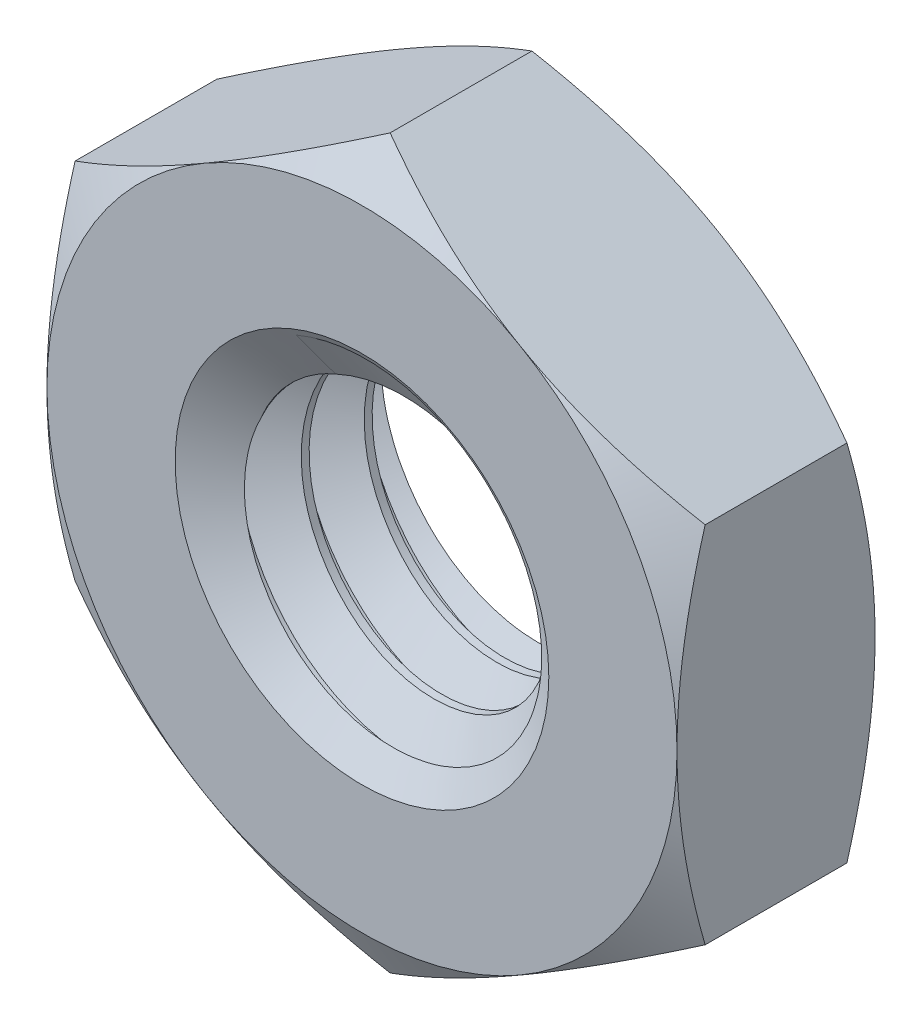
from build123d import *

# Parameters (mm, degrees)
SKETCH3_R                    = 2
BOSS_EXTRUDE1_DEPTH          = 1.1
SKETCH4_OUTSIDE_W            = 45.824
SKETCH4_OUTSIDE_H            = 46.906
SKETCH4_OUTSIDE_R            = 3.5
CUT_EXTRUDE1_DEPTH           = 10
CUT_EXTRUDE1_DRAFT           = -60
SKETCH4_OUTSIDE_R_2          = 2.075777223
CUT_EXTRUDE1_PROFILE_2_DEPTH = 10
CUT_EXTRUDE1_PROFILE_2_DRAFT = -60
MIRROR1_COPY_1_SKETCH_W      = 45.824
MIRROR1_COPY_1_SKETCH_H      = 46.906
MIRROR1_COPY_1_SKETCH_R      = 3.5
MIRROR1_COPY_1_DEPTH         = 10
MIRROR1_COPY_1_DRAFT         = -60
MIRROR1_COPY_2_SKETCH_R      = 2.075777223
MIRROR1_COPY_2_DEPTH         = 10
MIRROR1_COPY_2_DRAFT         = -60
MIRROR1_COPY_3_SKETCH_R      = 2.075777223
MIRROR1_COPY_3_DEPTH         = 10
MIRROR1_COPY_3_DRAFT         = -60
SWEEP1_PITCH                 = 0.7
SKETCH8_R                    = 2.075777223
CUT_EXTRUDE2_OTHER_WAY_DEPTH = 7.0926749


# Read off the part's stored shape, not the designer's step: Mirror2
with BuildPart() as part:
    # Sketch3 → Boss-Extrude1 (new, symmetric)
    with BuildSketch(Plane.XY):
        Polygon((-3.5, 2.020725942), (-3.5, -2.020725942), (0, -4.041451884), (3.5, -2.020725942), (3.5, 2.020725942), (0, 4.041451884), align=None)
        Circle(SKETCH3_R, mode=Mode.SUBTRACT)
    extrude(amount=BOSS_EXTRUDE1_DEPTH, both=True)


with BuildPart() as cut_extrude1_tool:
    # Sketch4 outside → Cut-Extrude1 (with draft: the straight prism first)
    with BuildSketch(Plane.XY.offset(1.1)):
        Rectangle(SKETCH4_OUTSIDE_W, SKETCH4_OUTSIDE_H)
        Circle(SKETCH4_OUTSIDE_R, mode=Mode.SUBTRACT)
    extrude(amount=-CUT_EXTRUDE1_DEPTH)
    # Cut-Extrude1: the draft: its side faces are tilted about the plane it starts from
    cut_extrude1_sides = [cut_extrude1_tool.faces().sort_by_distance(p)[0] for p in [
        (0, -23.453, -3.9),
        (22.912, 0, -3.9),
        (0, 23.453, -3.9),
        (-22.912, 0, -3.9),
        (-3.5, 0, -3.9),
    ]]
    draft(cut_extrude1_sides, Plane.XY.offset(1.1), CUT_EXTRUDE1_DRAFT)


with BuildPart() as part_1:
    add(part.part)

    # Cut-Extrude1: cut by cut_extrude1_tool
    add(cut_extrude1_tool.part, mode=Mode.SUBTRACT)


with BuildPart() as cut_extrude1_profile_2_tool:
    # Sketch4 outside → Cut-Extrude1 profile 2 (with draft: the straight prism first)
    with BuildSketch(Plane.XY.offset(1.1)):
        Circle(SKETCH4_OUTSIDE_R_2)
    extrude(amount=-CUT_EXTRUDE1_PROFILE_2_DEPTH)
    # Cut-Extrude1 profile 2: the draft: its side faces are tilted about the plane it starts from
    cut_extrude1_profile_2_sides = [cut_extrude1_profile_2_tool.faces().sort_by_distance(p)[0] for p in [
        (-2.075777223, 0, -3.9),
    ]]
    draft(cut_extrude1_profile_2_sides, Plane.XY.offset(1.1), CUT_EXTRUDE1_PROFILE_2_DRAFT)


with BuildPart() as part_2:
    add(part_1.part)

    # Cut-Extrude1 profile 2: cut by cut_extrude1_profile_2_tool
    add(cut_extrude1_profile_2_tool.part, mode=Mode.SUBTRACT)


with BuildPart() as mirror1_copy_1_tool:
    # Mirror1 copy 1 sketch → Mirror1 copy 1 (with draft: the straight prism first)
    with BuildSketch(Plane(origin=(0, 0, -1.1), x_dir=(1, 0, 0), z_dir=(0, 0, -1))):
        Rectangle(MIRROR1_COPY_1_SKETCH_W, MIRROR1_COPY_1_SKETCH_H)
        Circle(MIRROR1_COPY_1_SKETCH_R, mode=Mode.SUBTRACT)
    extrude(amount=-MIRROR1_COPY_1_DEPTH)
    # Mirror1 copy 1: the draft: its side faces are tilted about the plane it starts from
    mirror1_copy_1_sides = [mirror1_copy_1_tool.faces().sort_by_distance(p)[0] for p in [
        (0, -23.453, 3.9),
        (22.912, 0, 3.9),
        (0, 23.453, 3.9),
        (-22.912, 0, 3.9),
        (-3.5, 0, 3.9),
    ]]
    draft(mirror1_copy_1_sides, Plane(origin=(0, 0, -1.1), x_dir=(1, 0, 0), z_dir=(0, 0, -1)), MIRROR1_COPY_1_DRAFT)


with BuildPart() as part_3:
    add(part_2.part)

    # Mirror1 copy 1: cut by mirror1_copy_1_tool
    add(mirror1_copy_1_tool.part, mode=Mode.SUBTRACT)


with BuildPart() as mirror1_copy_2_tool:
    # Mirror1 copy 2 sketch → Mirror1 copy 2 (with draft: the straight prism first)
    with BuildSketch(Plane(origin=(0, 0, -1.1), x_dir=(1, 0, 0), z_dir=(0, 0, -1))):
        Circle(MIRROR1_COPY_2_SKETCH_R)
    extrude(amount=-MIRROR1_COPY_2_DEPTH)
    # Mirror1 copy 2: the draft: its side faces are tilted about the plane it starts from
    mirror1_copy_2_sides = [mirror1_copy_2_tool.faces().sort_by_distance(p)[0] for p in [
        (-2.075777223, 0, 3.9),
    ]]
    draft(mirror1_copy_2_sides, Plane(origin=(0, 0, -1.1), x_dir=(1, 0, 0), z_dir=(0, 0, -1)), MIRROR1_COPY_2_DRAFT)


with BuildPart() as part_4:
    add(part_3.part)

    # Mirror1 copy 2: cut by mirror1_copy_2_tool
    add(mirror1_copy_2_tool.part, mode=Mode.SUBTRACT)


with BuildPart() as mirror1_copy_3_tool:
    # Mirror1 copy 3 sketch → Mirror1 copy 3 (with draft: the straight prism first)
    with BuildSketch(Plane(origin=(0, 0, -1.1), x_dir=(1, 0, 0), z_dir=(0, 0, -1))):
        Circle(MIRROR1_COPY_3_SKETCH_R)
    extrude(amount=-MIRROR1_COPY_3_DEPTH)
    # Mirror1 copy 3: the draft: its side faces are tilted about the plane it starts from
    mirror1_copy_3_sides = [mirror1_copy_3_tool.faces().sort_by_distance(p)[0] for p in [
        (-2.075777223, 0, 3.9),
    ]]
    draft(mirror1_copy_3_sides, Plane(origin=(0, 0, -1.1), x_dir=(1, 0, 0), z_dir=(0, 0, -1)), MIRROR1_COPY_3_DRAFT)


with BuildPart() as part_5:
    add(part_4.part)

    # Mirror1 copy 3: cut by mirror1_copy_3_tool
    add(mirror1_copy_3_tool.part, mode=Mode.SUBTRACT)

    # Sweep1: the profile of Sketch7 screwed along a right-hand helix of 4.142857 turns, 6 arcs to a turn; built about Z, then put on its axis
    sweep1_z = Axis((0, 0, 0), (0, 0, 1))
    sweep1_corners = [(2.037888611, 0, -0.634375), (2.037888611, 0, 0.021875), (1.545336663, 0, -0.2625), (1.545336663, 0, -0.35)]
    with BuildLine(mode=Mode.PRIVATE) as sweep1_profile:
        Line(sweep1_corners[0], sweep1_corners[1])
        Line(sweep1_corners[1], sweep1_corners[2])
        Line(sweep1_corners[2], sweep1_corners[3])
        Line(sweep1_corners[3], sweep1_corners[0])
    sweep1_cap = Face(sweep1_profile.wire())
    sweep1_turn_angles = [0, 30, 60, 90, 120, 150, 180, 210, 240, 270, 300, 330, 360]
    sweep1_turn_weights = [1, 0.8660254037844387, 1, 0.8660254037844387, 1, 0.8660254037844387, 1, 0.8660254037844387, 1, 0.8660254037844387, 1, 0.8660254037844387, 1]
    sweep1_turn_rails = [Edge.make_bspline([Vector(p[0], p[1], 0).rotate(sweep1_z, sweep1_turn_angles[k]) / sweep1_turn_weights[k] + Vector(0, 0, p[2] + SWEEP1_PITCH * sweep1_turn_angles[k] / 360) for k in range(13)], [0, 0, 0, 1, 1, 2, 2, 3, 3, 4, 4, 5, 5, 6, 6, 6], 2, sweep1_turn_weights) for p in sweep1_corners]
    sweep1_turn_sides = [Face.make_surface_from_curves(sweep1_turn_rails[p[0]], sweep1_turn_rails[p[1]]) for p in [(0, 1), (1, 2), (2, 3), (3, 0)]]
    sweep1_last_angles = [1440, 1465.714285714, 1491.428571429]
    sweep1_last_weights = [1, 0.9009688679024032, 1]
    sweep1_last_rails = [Edge.make_bspline([Vector(p[0], p[1], 0).rotate(sweep1_z, sweep1_last_angles[k]) / sweep1_last_weights[k] + Vector(0, 0, p[2] + SWEEP1_PITCH * sweep1_last_angles[k] / 360) for k in range(3)], [0, 0, 0, 1, 1, 1], 2, sweep1_last_weights) for p in sweep1_corners]
    sweep1_last_sides = [Face.make_surface_from_curves(sweep1_last_rails[p[0]], sweep1_last_rails[p[1]]) for p in [(0, 1), (1, 2), (2, 3), (3, 0)]]
    sweep1 = Plane(origin=(0, 0, 1.1), x_dir=(0, 1, 0), z_dir=(0, 0, -1)) * Solid(Shell([*[p.moved(Location((0, 0, SWEEP1_PITCH * i))) for i in range(4) for p in sweep1_turn_sides], *sweep1_last_sides, sweep1_cap, sweep1_cap.rotate(sweep1_z, 1491.428571429).moved(Location((0, 0, SWEEP1_PITCH * 1491.428571429 / 360)))]))
    add(sweep1)

    # Cut-Extrude2 cone 1 section (through the dimple's axis) → Cut-Extrude2 (revolve, cut)
    with BuildSketch(Plane(origin=(0, 0, 1.1), x_dir=(0, -1, 0), z_dir=(1, 0, 0))):
        Polygon((0, 0), (2.075777223, 0), (0, 1.198450538), align=None)
    revolve(axis=Axis((0, 0, 1.1), (0, 0, -1)), mode=Mode.SUBTRACT)

    # Sketch8 → Cut-Extrude2 other way (cut)
    with BuildSketch(Plane.XY.offset(1.1)):
        Circle(SKETCH8_R)
    extrude(amount=CUT_EXTRUDE2_OTHER_WAY_DEPTH, mode=Mode.SUBTRACT)

    # Mirror2 outline → Mirror2 (revolve, cut)
    with BuildSketch(Plane.XZ):
        Polygon((2.075777223, -1.1), (1.545327333, -0.793744613), (1.545327333, -1.822829202), (2.075777223, -1.822829202), align=None)
    revolve(axis=Axis((0, 0, 0), (0, 0, 1)), mode=Mode.SUBTRACT)


solid = part_5.part
